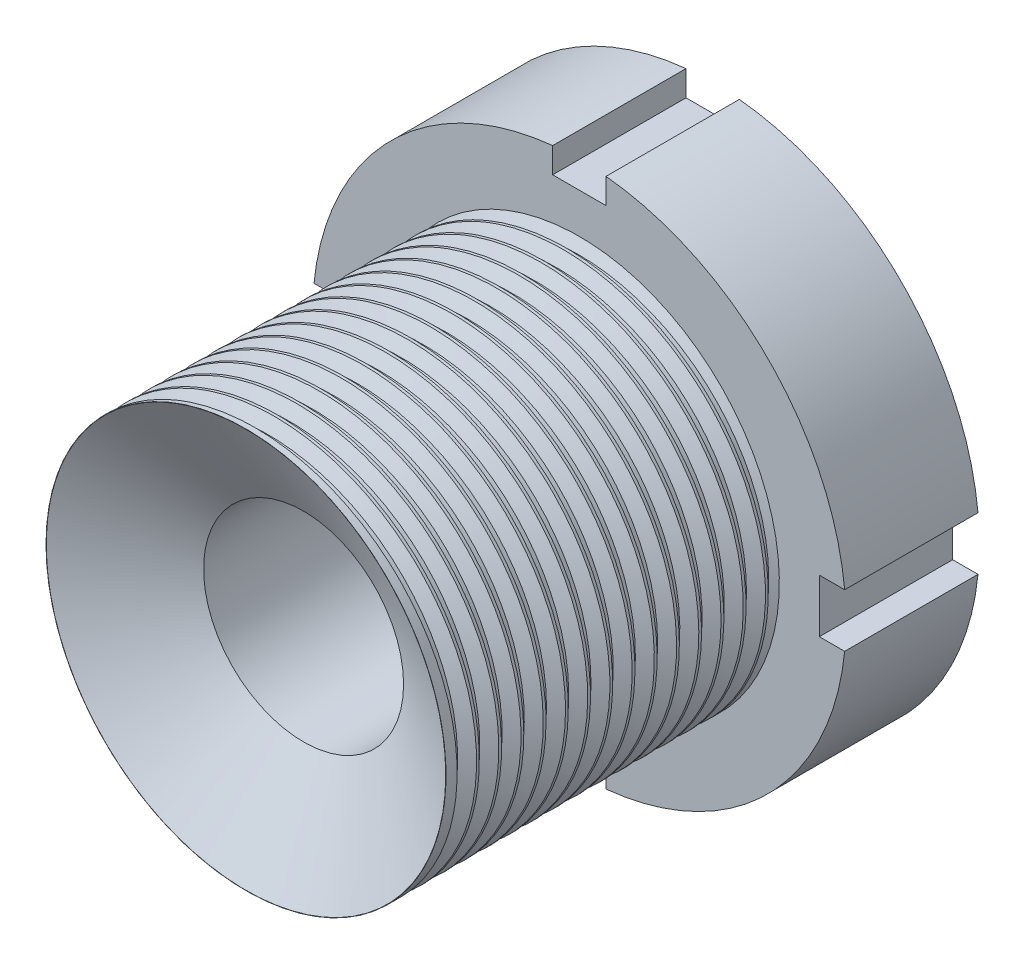
from build123d import *

# Parameters (mm, degrees)
SKETCH1_R                                        = 12.7
BOSS_EXTRUDE1_DEPTH                              = 6.35
SKETCH2_R                                        = 9.525
BOSS_EXTRUDE2_DEPTH                              = 15.875
SKETCH3_W                                        = 2.54
SKETCH3_H                                        = 2.265918967
SKETCH3_W_2                                      = 2.265918967
SKETCH3_H_2                                      = 2.54
CUT_EXTRUDE1_DEPTH                               = 29.575
THREAD1_PITCH                                    = 1.058333333
CSK_FOR_3_8_FLAT_HEAD_MACHINE_SCREW2_D           = 9.525
CSK_FOR_3_8_FLAT_HEAD_MACHINE_SCREW2_CSINK_D     = 19.0246
CSK_FOR_3_8_FLAT_HEAD_MACHINE_SCREW2_CSINK_ANGLE = 120


with BuildPart() as part:
    # Sketch1 → Boss-Extrude1 (new body)
    with BuildSketch(Plane.XY):
        Circle(SKETCH1_R)
    extrude(amount=BOSS_EXTRUDE1_DEPTH)

    # Sketch2 → Boss-Extrude2 (add)
    with BuildSketch(Plane.XY.offset(6.35)):
        Circle(SKETCH2_R)
    extrude(amount=BOSS_EXTRUDE2_DEPTH)

    # Sketch3 → Cut-Extrude1 (cut, through all)
    with BuildSketch(Plane(origin=(0, 0, 0), x_dir=(-1, 0, 0), z_dir=(0, 0, -1))):
        with Locations((0, 12.562959484)):
            Rectangle(SKETCH3_W, SKETCH3_H)
        with Locations((12.562959484, 0)):
            Rectangle(SKETCH3_W_2, SKETCH3_H_2)
        with Locations((0, -12.562959484)):
            Rectangle(SKETCH3_W, SKETCH3_H)
        with Locations((-12.562959484, 0)):
            Rectangle(SKETCH3_W_2, SKETCH3_H_2)
    extrude(amount=-CUT_EXTRUDE1_DEPTH, mode=Mode.SUBTRACT)

    # Thread1: the profile of Thread Profile1 profile screwed along a right-hand helix of 15 turns, 8 arcs to a turn; built about Z, then put on its axis
    thread1_z = Axis((0, 0, 0), (0, 0, 1))
    thread1_corners = [(9.5253, 0, -0.000173205), (9.5253, 0, 0.926214869), (8.952160282, 0, 0.595312499), (8.952160282, 0, 0.330729165)]
    with BuildLine(mode=Mode.PRIVATE) as thread1_profile:
        Line(thread1_corners[0], thread1_corners[1])
        Line(thread1_corners[1], thread1_corners[2])
        Line(thread1_corners[2], thread1_corners[3])
        Line(thread1_corners[3], thread1_corners[0])
    thread1_cap = Face(thread1_profile.wire())
    thread1_turn_angles = [0, 22.5, 45, 67.5, 90, 112.5, 135, 157.5, 180, 202.5, 225, 247.5, 270, 292.5, 315, 337.5, 360]
    thread1_turn_weights = [1, 0.9238795325112867, 1, 0.9238795325112867, 1, 0.9238795325112867, 1, 0.9238795325112867, 1, 0.9238795325112867, 1, 0.9238795325112867, 1, 0.9238795325112867, 1, 0.9238795325112867, 1]
    thread1_turn_rails = [Edge.make_bspline([Vector(p[0], p[1], 0).rotate(thread1_z, thread1_turn_angles[k]) / thread1_turn_weights[k] + Vector(0, 0, p[2] + THREAD1_PITCH * thread1_turn_angles[k] / 360) for k in range(17)], [0, 0, 0, 1, 1, 2, 2, 3, 3, 4, 4, 5, 5, 6, 6, 7, 7, 8, 8, 8], 2, thread1_turn_weights) for p in thread1_corners]
    thread1_turn_sides = [Face.make_surface_from_curves(thread1_turn_rails[p[0]], thread1_turn_rails[p[1]]) for p in [(0, 1), (1, 2), (2, 3), (3, 0)]]
    thread1 = Plane(origin=(0, 0, 22.225), x_dir=(-1, 0, 0), z_dir=(0, 0, -1)) * Solid(Shell([*[p.moved(Location((0, 0, THREAD1_PITCH * i))) for i in range(15) for p in thread1_turn_sides], thread1_cap, thread1_cap.rotate(thread1_z, 5400).moved(Location((0, 0, THREAD1_PITCH * 5400 / 360)))]))
    add(thread1, mode=Mode.SUBTRACT)

    # CSK for 3/8 Flat Head Machine Screw2 (through all)
    with Locations(Plane.XY.offset(22.225)):
        with Locations((0, 0)):
            CounterSinkHole(CSK_FOR_3_8_FLAT_HEAD_MACHINE_SCREW2_D / 2, CSK_FOR_3_8_FLAT_HEAD_MACHINE_SCREW2_CSINK_D / 2, counter_sink_angle=CSK_FOR_3_8_FLAT_HEAD_MACHINE_SCREW2_CSINK_ANGLE)


solid = part.part
